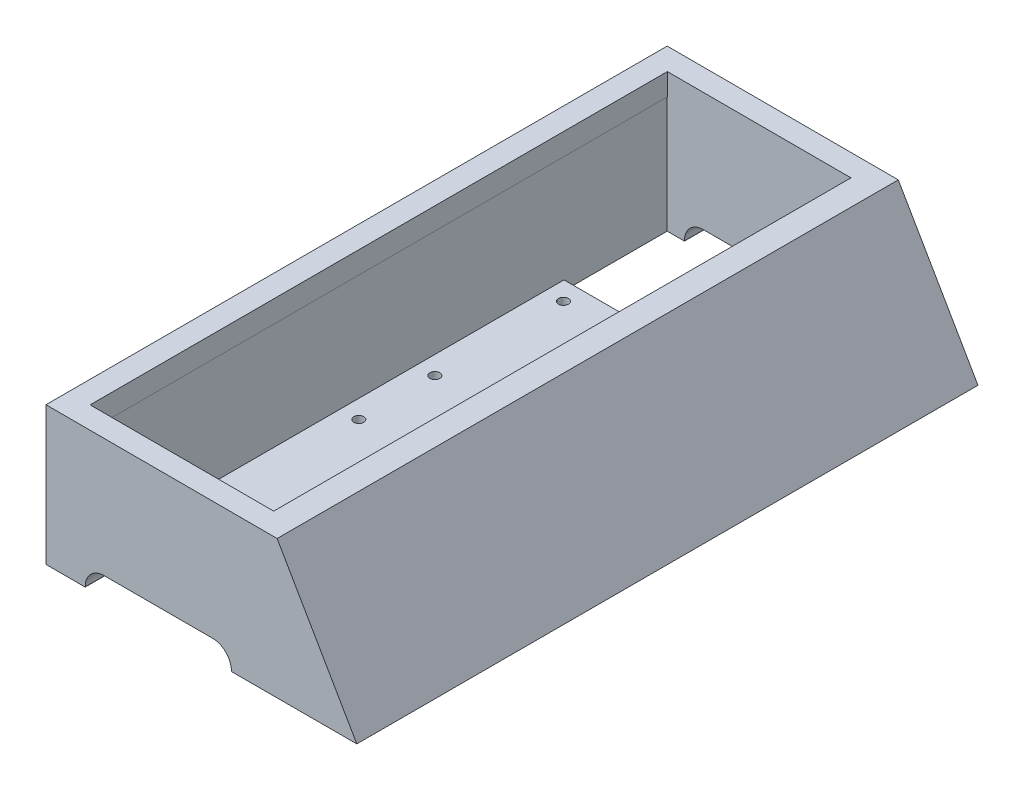
from build123d import *

# Parameters (mm, degrees)
BOSS_EXTRUDE1_DEPTH = 198
SHELL1_T            = -7
SKETCH2_W           = 184
SKETCH2_H           = 91.833810452
CUT_EXTRUDE1_DEPTH  = 10
SKETCH3_W           = 51.015734787
SKETCH3_H           = 184
CUT_EXTRUDE3_DEPTH  = 10
SKETCH4_W           = 43.227096231
SKETCH4_H           = 118.22
SKETCH4_W_2         = 10
SKETCH4_H_2         = 10
BOSS_EXTRUDE2_DEPTH = 3
SKETCH6_R           = 1.585
CUT_EXTRUDE5_DEPTH  = 10
SKETCH8_R           = 1.585
CUT_EXTRUDE6_DEPTH  = 10
SKETCH9_W           = 46.592666587
SKETCH9_H           = 6.179476357
CUT_EXTRUDE7_DEPTH  = 10
FILLET1_R           = 6
FILLET2_R           = 6


with BuildPart() as part:
    # Sketch1 → Boss-Extrude1 (new body)
    with BuildSketch(Plane.XY):
        Polygon((0, 0), (99.07, 0), (73.665, 44.002750766), (0, 44.1), align=None)
    extrude(amount=BOSS_EXTRUDE1_DEPTH)

    # Shell1
    shell1_openings = [part.faces().sort_by_distance(p)[0] for p in [
        (49.535, 0, 99),
    ]]
    offset(amount=SHELL1_T, openings=shell1_openings, kind=Kind.INTERSECTION)

    # Sketch2 → Cut-Extrude1 (cut)
    with BuildSketch(Plane(origin=(68.240322174, 39.398568376, 0), x_dir=(0, 0, 1), z_dir=(-0.866025403784436, -0.5000000000000048, 0))):
        with Locations((99, 0.42335711)):
            Rectangle(SKETCH2_W, SKETCH2_H)
    extrude(amount=CUT_EXTRUDE1_DEPTH, mode=Mode.SUBTRACT)

    # Sketch3 → Cut-Extrude3 (cut)
    with BuildSketch(Plane(origin=(0.058218743, 44.099923142, 0), x_dir=(0.9999991285962467, -0.001320154061894519, 0), z_dir=(0.001320154061894519, 0.9999991285962467, 0))):
        with Locations((32.507861294, -99)):
            Rectangle(SKETCH3_W, SKETCH3_H)
    extrude(amount=-CUT_EXTRUDE3_DEPTH, mode=Mode.SUBTRACT)

    # Sketch4 → Boss-Extrude2 (add)
    with BuildSketch(Plane.XZ):
        with Locations((28.613548116, 99)):
            Rectangle(SKETCH4_W, SKETCH4_H)
        with Locations((79.592666587, 186)):
            Rectangle(SKETCH4_W_2, SKETCH4_H_2)
        with Locations((79.592666587, 12)):
            Rectangle(SKETCH4_W_2, SKETCH4_H_2)
    extrude(amount=-BOSS_EXTRUDE2_DEPTH)

    # Sketch6 → Cut-Extrude5 (cut)
    with BuildSketch(Plane(origin=(0, 3, 0), x_dir=(1, 0, 0), z_dir=(0, 1, 0))):
        with Locations((12.830469551, -45.887182752)):
            Circle(SKETCH6_R)
        with Locations((12.830469551, -86.887182752)):
            Circle(SKETCH6_R)
        with Locations((12.830469551, -111.112817248)):
            Circle(SKETCH6_R)
        with Locations((12.830469551, -152.112817248)):
            Circle(SKETCH6_R)
    extrude(amount=-CUT_EXTRUDE5_DEPTH, mode=Mode.SUBTRACT)

    # Sketch8 → Cut-Extrude6 (cut)
    with BuildSketch(Plane(origin=(0, 0, 0), x_dir=(-1, 0, 0), z_dir=(0, -1, 0))):
        with Locations((-79.592666587, -186)):
            Circle(SKETCH8_R)
        with Locations((-79.592666587, -12)):
            Circle(SKETCH8_R)
    extrude(amount=-CUT_EXTRUDE6_DEPTH, mode=Mode.SUBTRACT)

    # Sketch9 → Cut-Extrude7 (cut)
    with BuildSketch(Plane.XY.offset(198)):
        with Locations((35.796333293, 3.089738179)):
            Rectangle(SKETCH9_W, SKETCH9_H)
    cut_extrude7 = extrude(amount=-CUT_EXTRUDE7_DEPTH, mode=Mode.SUBTRACT)

    # Mirror1: Cut-Extrude7 across plane
    add(cut_extrude7.mirror(Plane(origin=(0, 0, 99), x_dir=(1, 0, 0), z_dir=(0, 0, -1))), mode=Mode.SUBTRACT)

    # Fillet1
    fillet1_edges = [part.edges().sort_by_distance(p)[0] for p in [
        (12.5, 6.179476357, 3.5),
        (59.092666587, 6.179476357, 3.5),
    ]]
    fillet(fillet1_edges, radius=FILLET1_R)

    # Fillet2
    fillet2_edges = [part.edges().sort_by_distance(p)[0] for p in [
        (59.092666587, 6.179476357, 194.5),
        (12.5, 6.179476357, 194.5),
    ]]
    fillet(fillet2_edges, radius=FILLET2_R)


solid = part.part
